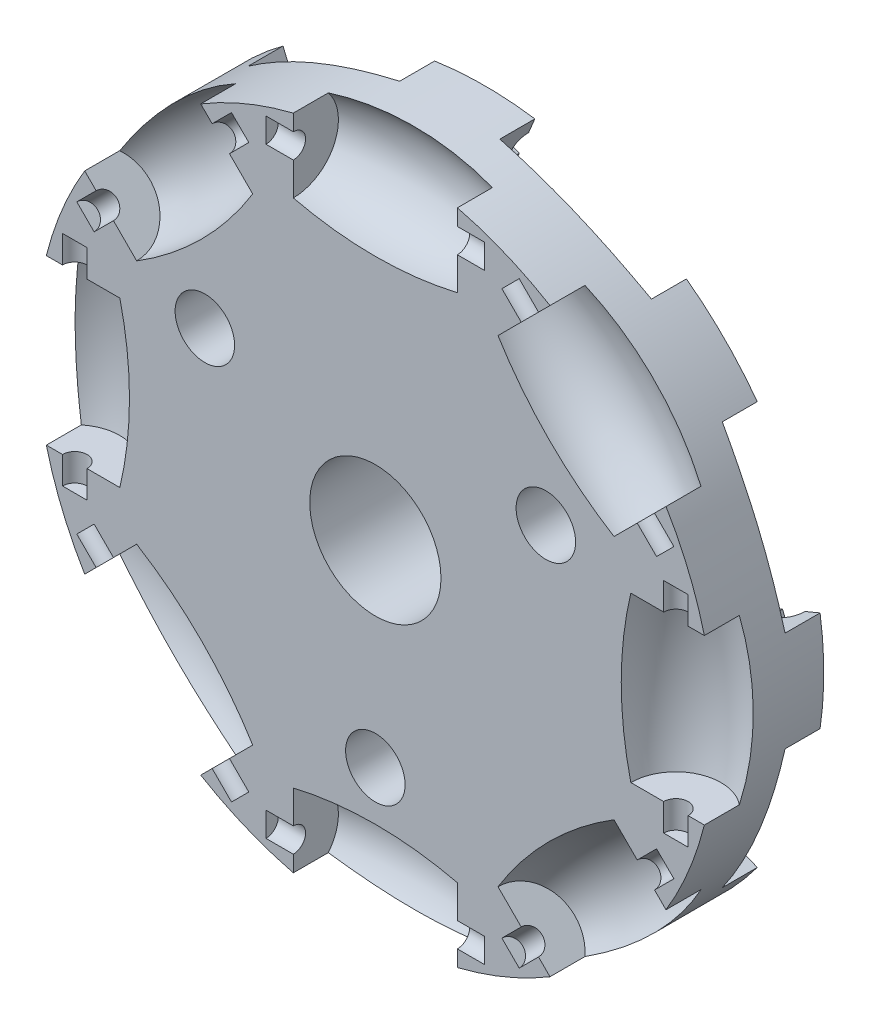
from build123d import *

# Parameters (mm, degrees)
SKETCH1_R           = 24.60625
BOSS_EXTRUDE1_DEPTH = 3.96875
SKETCH6_R           = 0.889
CUT_EXTRUDE2_DEPTH  = 7.9375
SKETCH10_R          = 0.889
CUT_EXTRUDE3_DEPTH  = 7.9375
CIRPATTERN1_COUNT   = 8
SKETCH16_R          = 2.159
CUT_EXTRUDE7_DEPTH  = 36.69228202
SKETCH17_R          = 4.7625
CUT_EXTRUDE8_DEPTH  = 36.69228202


with BuildPart() as part:
    # Sketch1 → Boss-Extrude1 (new, symmetric)
    with BuildSketch(Plane.XY):
        Circle(SKETCH1_R)
    extrude(amount=BOSS_EXTRUDE1_DEPTH, both=True)

    # Sketch5 → Cut-Revolve5 (revolve, cut)
    with BuildSketch(Plane.XY.offset(3.96875)):
        with BuildLine():
            Line((-5.953125, 25.084263269), (-5.953125, 21.81225))
            Line((-5.953125, 21.81225), (5.953125, 21.81225))
            Line((5.953125, 21.81225), (5.953125, 25.084263269))
            ThreePointArc((5.953125, 25.084263269), (0, 25.781), (-5.953125, 25.084263269))
        make_face()
    cut_revolve5 = revolve(axis=Axis((-5.953125, 21.81225, 3.96875), (1, 0, 0)), mode=Mode.SUBTRACT)

    # Sketch8 → Cut-Revolve6 (revolve, cut)
    with BuildSketch(Plane.XY.offset(-3.96875)):
        with BuildLine():
            Line((4.099361624, 25.45299973), (2.847216356, 22.430053641))
            Line((2.847216356, 22.430053641), (13.84715704, 17.873729025))
            Line((13.84715704, 17.873729025), (15.099302308, 20.896675114))
            ThreePointArc((15.099302308, 20.896675114), (9.86596157, 23.818538228), (4.099361624, 25.45299973))
        make_face()
    cut_revolve6 = revolve(axis=Axis((2.847216356, 22.430053641, -3.96875), (-0.9238795325112865, 0.3826834323650905, 0)), mode=Mode.SUBTRACT)

    # Sketch6 → Cut-Extrude2 (cut, symmetric)
    with BuildSketch(Plane(origin=(0, 0, 0), x_dir=(0, 0, -1), z_dir=(1, 0, 0))):
        with Locations((-3.96875, 21.81225)):
            Circle(SKETCH6_R)
    cut_extrude2 = extrude(amount=CUT_EXTRUDE2_DEPTH, both=True, mode=Mode.SUBTRACT)

    # Sketch10 → Cut-Extrude3 (cut, symmetric)
    with BuildSketch(Plane(origin=(0, 0, 0), x_dir=(0, 0, -1), z_dir=(0.9238795325112866, -0.38268343236509017, 0))):
        with Locations((3.96875, 21.81225)):
            Circle(SKETCH10_R)
    cut_extrude3 = extrude(amount=CUT_EXTRUDE3_DEPTH, both=True, mode=Mode.SUBTRACT)

    # CirPattern1: Cut-Revolve5, Cut-Revolve6, Cut-Extrude2, Cut-Extrude3 ×8 about axis
    cirpattern1_axis = Axis((0, 0, 3.96875), (0, 0, -1))
    add([cut_revolve5.rotate(cirpattern1_axis, i * 360 / CIRPATTERN1_COUNT) for i in range(1, CIRPATTERN1_COUNT)], mode=Mode.SUBTRACT)
    add([cut_revolve6.rotate(cirpattern1_axis, i * 360 / CIRPATTERN1_COUNT) for i in range(1, CIRPATTERN1_COUNT)], mode=Mode.SUBTRACT)
    add([cut_extrude2.rotate(cirpattern1_axis, i * 360 / CIRPATTERN1_COUNT) for i in range(1, CIRPATTERN1_COUNT)], mode=Mode.SUBTRACT)
    add([cut_extrude3.rotate(cirpattern1_axis, i * 360 / CIRPATTERN1_COUNT) for i in range(1, CIRPATTERN1_COUNT)], mode=Mode.SUBTRACT)

    # Sketch16 → Cut-Extrude7 (cut, through all)
    with BuildSketch(Plane.XY.offset(3.96875)):
        with Locations((0, -14.2875)):
            Circle(SKETCH16_R)
        with Locations((-12.373337957, 7.14375)):
            Circle(SKETCH16_R)
        with Locations((12.373337957, 7.14375)):
            Circle(SKETCH16_R)
    extrude(amount=-CUT_EXTRUDE7_DEPTH, mode=Mode.SUBTRACT)

    # Sketch17 → Cut-Extrude8 (cut, through all)
    with BuildSketch(Plane.XY.offset(3.96875)):
        Circle(SKETCH17_R)
    extrude(amount=-CUT_EXTRUDE8_DEPTH, mode=Mode.SUBTRACT)


solid = part.part
